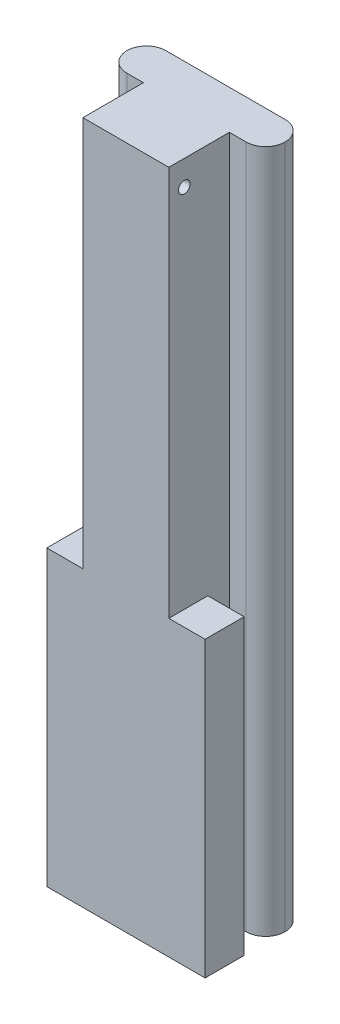
from build123d import *

# Parameters (mm, degrees)
SKETCH1_W           = 205.763637231
SKETCH1_H           = 129.455055738
BOSS_EXTRUDE1_DEPTH = 889.508
SKETCH2_W           = 34.228088198
SKETCH2_H           = 27.935874949
CUT_EXTRUDE1_DEPTH  = 1151.636
SKETCH3_W           = 34.228088198
SKETCH3_H           = 27.935874949
CUT_EXTRUDE2_DEPTH  = 1331.214
FILLET3_R           = 25.4
FILLET4_R           = 25.4
FILLET5_R           = 25.4
FILLET7_R           = 25.4
SKETCH4_W           = 12.650207524
SKETCH4_H           = 27.935874949
BOSS_EXTRUDE3_DEPTH = 874.268
SKETCH5_W           = 12.621373824
SKETCH5_H           = 27.935874949
CUT_EXTRUDE5_DEPTH  = 1063.752
SKETCH6_W           = 12.913753515
SKETCH6_H           = 27.935874949
CUT_EXTRUDE6_DEPTH  = 1244.346
SKETCH8_W           = 46.849462022
SKETCH8_H           = 50.759590395
CUT_EXTRUDE7_DEPTH  = 508
SKETCH9_W           = 47.141841713
SKETCH9_H           = 50.759590395
CUT_EXTRUDE8_DEPTH  = 508
SKETCH10_R          = 7.658892277
CUT_EXTRUDE9_DEPTH  = 263.652


with BuildPart() as part:
    # Sketch1 → Boss-Extrude1 (new body)
    with BuildSketch(Plane(origin=(0, 0, 0), x_dir=(1, 0, 0), z_dir=(0, 1, 0))):
        with Locations((102.881818616, -64.727527869)):
            Rectangle(SKETCH1_W, SKETCH1_H)
    extrude(amount=BOSS_EXTRUDE1_DEPTH)

    # Sketch2 → Cut-Extrude1 (cut)
    with BuildSketch(Plane(origin=(0, 889.508, 0), x_dir=(1, 0, 0), z_dir=(0, 1, 0))):
        with Locations((17.114044099, -64.727527869)):
            Rectangle(SKETCH2_W, SKETCH2_H)
    extrude(amount=-CUT_EXTRUDE1_DEPTH, mode=Mode.SUBTRACT)

    # Sketch3 → Cut-Extrude2 (cut)
    with BuildSketch(Plane(origin=(0, 889.508, 0), x_dir=(1, 0, 0), z_dir=(0, 1, 0))):
        with Locations((188.649593132, -64.727527869)):
            Rectangle(SKETCH3_W, SKETCH3_H)
    extrude(amount=-CUT_EXTRUDE2_DEPTH, mode=Mode.SUBTRACT)

    # Fillet3
    fillet3_edges = [part.edges().sort_by_distance(p)[0] for p in [
        (0, 444.754, 0),
    ]]
    fillet(fillet3_edges, radius=FILLET3_R)

    # Fillet4
    fillet4_edges = [part.edges().sort_by_distance(p)[0] for p in [
        (205.763637231, 444.754, 0),
    ]]
    fillet(fillet4_edges, radius=FILLET4_R)

    # Fillet5
    # the kernel refuses this fillet: 25.4 mm, written as the material it takes off along each edge
    with BuildSketch(Plane(origin=(205.763637231, 953.008, 50.759590394), x_dir=(0, 0, -1), z_dir=(0, -1, 0))) as fillet5_piece_1:
        with BuildLine():
            CenterArc((FILLET5_R, -FILLET5_R), FILLET5_R, 90, 90)
            Line((0, -FILLET5_R), (0, 0))
            Line((0, 0), (FILLET5_R, 0))
        make_face()
    extrude(amount=1016.508, mode=Mode.SUBTRACT)

    # Fillet7
    # the kernel refuses this fillet: 25.4 mm, written as the material it takes off along each edge
    with BuildSketch(Plane(origin=(0, 953.008, 50.759590394), x_dir=(0, 0, -1), z_dir=(0, -1, 0))) as fillet7_piece_1:
        with BuildLine():
            CenterArc((FILLET7_R, FILLET7_R), FILLET7_R, 180, 90)
            Line((0, FILLET7_R), (0, 0))
            Line((0, 0), (FILLET7_R, 0))
        make_face()
    extrude(amount=1016.508, mode=Mode.SUBTRACT)

    # Sketch4 → Boss-Extrude3 (add)
    with BuildSketch(Plane(origin=(0, 889.508, 0), x_dir=(1, 0, 0), z_dir=(0, 1, 0))):
        with Locations((40.55319196, -64.727527869)):
            Rectangle(SKETCH4_W, SKETCH4_H)
    extrude(amount=-BOSS_EXTRUDE3_DEPTH)

    # Sketch5 → Cut-Extrude5 (cut)
    with BuildSketch(Plane(origin=(0, 889.508, 0), x_dir=(1, 0, 0), z_dir=(0, 1, 0))):
        with Locations((40.53877511, -64.727527869)):
            Rectangle(SKETCH5_W, SKETCH5_H)
    extrude(amount=-CUT_EXTRUDE5_DEPTH, mode=Mode.SUBTRACT)

    # Sketch6 → Cut-Extrude6 (cut)
    with BuildSketch(Plane(origin=(0, 889.508, 0), x_dir=(1, 0, 0), z_dir=(0, 1, 0))):
        with Locations((165.078672276, -64.727527869)):
            Rectangle(SKETCH6_W, SKETCH6_H)
    extrude(amount=-CUT_EXTRUDE6_DEPTH, mode=Mode.SUBTRACT)

    # Sketch8 → Cut-Extrude7 (cut)
    with BuildSketch(Plane(origin=(0, 889.508, 0), x_dir=(1, 0, 0), z_dir=(0, 1, 0))):
        with Locations((23.424731011, -104.075260541)):
            Rectangle(SKETCH8_W, SKETCH8_H)
    extrude(amount=-CUT_EXTRUDE7_DEPTH, mode=Mode.SUBTRACT)

    # Sketch9 → Cut-Extrude8 (cut)
    with BuildSketch(Plane(origin=(0, 889.508, 0), x_dir=(1, 0, 0), z_dir=(0, 1, 0))):
        with Locations((182.192716375, -104.075260541)):
            Rectangle(SKETCH9_W, SKETCH9_H)
    extrude(amount=-CUT_EXTRUDE8_DEPTH, mode=Mode.SUBTRACT)

    # Sketch10 → Cut-Extrude9 (cut)
    with BuildSketch(Plane.ZY.offset(-46.849462022)):
        with Locations((109.367874663, 857.026947913)):
            Circle(SKETCH10_R)
    extrude(amount=-CUT_EXTRUDE9_DEPTH, mode=Mode.SUBTRACT)


solid = part.part
